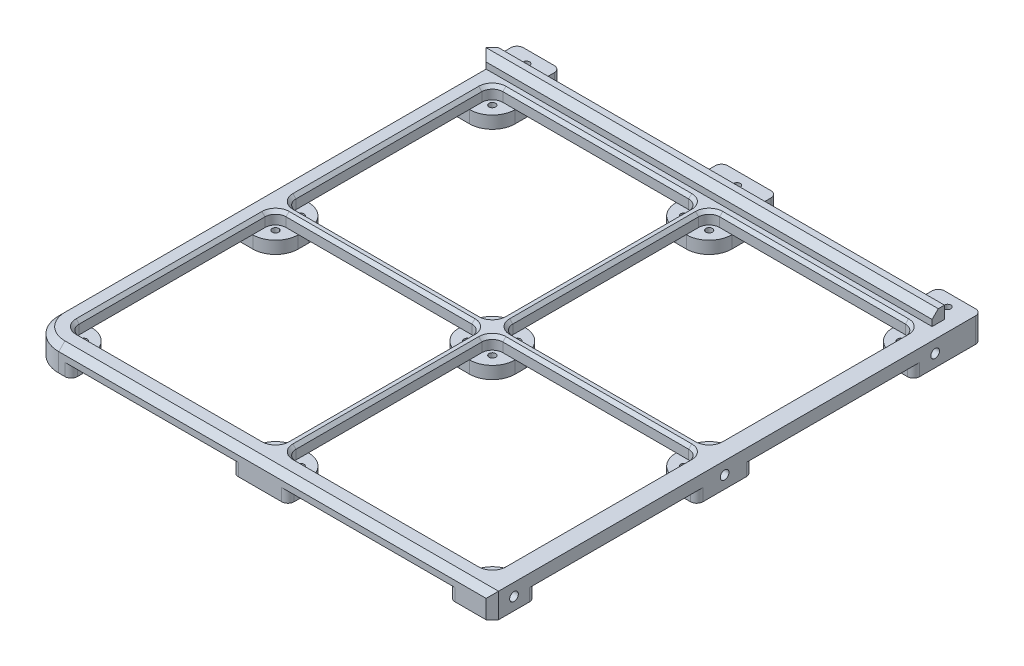
from build123d import *

# Parameters (mm, degrees)
SKETCH1_W              = 225
SKETCH1_H              = 225
SKETCH1_W_2            = 100
SKETCH1_H_2            = 100
BOSS_EXTRUDE1_DEPTH    = 6
SKETCH10_R             = 1.6
BOSS_EXTRUDE9_DEPTH    = 6
FILLET1_R              = 5
SKETCH18_W             = 12
SKETCH18_H             = 27
BOSS_EXTRUDE11_DEPTH   = 12
SKETCH18_H_2           = 21
BOSS_EXTRUDE11_2_DEPTH = 12
BOSS_EXTRUDE11_3_DEPTH = 12
SKETCH18_W_2           = 21
SKETCH18_H_3           = 12
BOSS_EXTRUDE11_4_DEPTH = 12
SKETCH18_W_3           = 27
BOSS_EXTRUDE11_5_DEPTH = 12
SKETCH19_W             = 12
SKETCH19_H             = 21
BOSS_EXTRUDE13_DEPTH   = 12
SKETCH19_H_2           = 27
BOSS_EXTRUDE13_2_DEPTH = 12
BOSS_EXTRUDE13_3_DEPTH = 12
SKETCH21_W             = 6
SKETCH21_H             = 6
BOSS_EXTRUDE14_DEPTH   = 183
SKETCH22_W             = 6
SKETCH22_H             = 6
BOSS_EXTRUDE16_DEPTH   = 183
SKETCH24_W             = 6
SKETCH24_H             = 6
BOSS_EXTRUDE18_DEPTH   = 183
FILLET2_R              = 15
SPLIT2_START           = -6
SPLIT2_OUTLINE_W       = 12
SPLIT2_OUTLINE_H       = 12
SPLIT2_DEPTH           = 12
SPLIT2_START_2         = -112.5
SPLIT2_2_OUTLINE_W     = 6
SPLIT2_2_OUTLINE_H     = 6
SPLIT2_2_DEPTH         = 225
SPLIT2_START_3         = -13.5
SPLIT2_3_DEPTH         = 27
SPLIT2_4_DEPTH         = 21
SPLIT2_START_4         = 91.5
SPLIT2_5_DEPTH         = 21
SPLIT2_START_5         = 112.5
SPLIT2_6_DEPTH         = 6
SPLIT2_START_6         = 118.5
SPLIT2_7_OUTLINE_R     = 1.6
SPLIT2_7_DEPTH         = 6
SPLIT2_START_7         = 6
SPLIT2_8_OUTLINE_W     = 6
SPLIT2_8_OUTLINE_H     = 6
SPLIT2_8_DEPTH         = 225
SPLIT2_START_8         = 105
SPLIT2_9_DEPTH         = 27
SPLIT2_10_DEPTH        = 21
SPLIT2_START_9         = 210
SPLIT2_11_DEPTH        = 21
SPLIT2_START_10        = -118.5
SPLIT2_12_DEPTH        = 6
SPLIT2_START_11        = -124.5
SPLIT2_13_OUTLINE_R    = 1.6
SPLIT2_13_DEPTH        = 6
SPLIT2_14_OUTLINE_W    = 6
SPLIT2_14_OUTLINE_H    = 6
SPLIT2_14_DEPTH        = 225
SPLIT2_15_DEPTH        = 27
SPLIT2_16_DEPTH        = 21
SPLIT2_17_DEPTH        = 21
SPLIT2_18_OUTLINE_R    = 1.6
SPLIT2_18_DEPTH        = 237
SPLIT2_19_DEPTH        = 12
SKETCH26_W             = 6
SKETCH26_H             = 6
BOSS_EXTRUDE20_DEPTH   = 219
SKETCH27_R             = 1.6
CUT_EXTRUDE1_DEPTH     = 169.761666263
SKETCH28_R             = 3
CUT_EXTRUDE2_DEPTH     = 4
SKETCH30_R             = 2.1
CUT_EXTRUDE3_DEPTH     = 6
CUT_EXTRUDE4_DEPTH     = 6
SKETCH32_R             = 1.6
CUT_EXTRUDE5_DEPTH     = 6
CHAMFER7_SIZE          = 1.5
CHAMFER3_SIZE          = 3
FILLET3_R              = 3


# Read off the part's stored shape, not the designer's step: Split2
with BuildPart() as part:
    # Sketch1 → Boss-Extrude1 (new body)
    with BuildSketch(Plane(origin=(0, 0, 0), x_dir=(1, 0, 0), z_dir=(0, 1, 0))):
        Rectangle(SKETCH1_W, SKETCH1_H)
        with Locations((-52.5, 52.5)):
            Rectangle(SKETCH1_W_2, SKETCH1_H_2, mode=Mode.SUBTRACT)
        with Locations((-52.5, -52.5)):
            Rectangle(SKETCH1_W_2, SKETCH1_H_2, mode=Mode.SUBTRACT)
        with Locations((52.5, -52.5)):
            Rectangle(SKETCH1_W_2, SKETCH1_H_2, mode=Mode.SUBTRACT)
        with Locations((52.5, 52.5)):
            Rectangle(SKETCH1_W_2, SKETCH1_H_2, mode=Mode.SUBTRACT)
    extrude(amount=BOSS_EXTRUDE1_DEPTH)

    # Sketch10 → Boss-Extrude9 (add)
    # profile 1 of 9: a face of its own
    with BuildSketch(Plane.XZ):
        with BuildLine():
            Line((-112.5, 91.5), (-102.5, 91.5))
            ThreePointArc((-102.5, 91.5), (-94.721825407, 94.721825407), (-91.5, 102.5))
            Line((-91.5, 102.5), (-91.5, 112.5))
            Line((-91.5, 112.5), (-112.5, 112.5))
            Line((-112.5, 112.5), (-112.5, 91.5))
        make_face()
        with Locations(Location((-98.9, 98.9, 0), (0, 0, 270))):
            Circle(SKETCH10_R, mode=Mode.SUBTRACT)
    # profile 2 of 9: a face of its own
    with BuildSketch(Plane.XZ):
        with BuildLine():
            Line((-2.5, 91.5), (2.5, 91.5))
            ThreePointArc((2.5, 91.5), (10.278174593, 94.721825407), (13.5, 102.5))
            Line((13.5, 102.5), (13.5, 112.5))
            Line((13.5, 112.5), (-13.5, 112.5))
            Line((-13.5, 112.5), (-13.5, 102.5))
            ThreePointArc((-13.5, 102.5), (-10.278174593, 94.721825407), (-2.5, 91.5))
        make_face()
        with Locations(Location((-6.1, 98.9, 0), (0, 0, 270))):
            Circle(SKETCH10_R, mode=Mode.SUBTRACT)
        with Locations(Location((6.1, 98.9, 0), (0, 0, 90))):
            Circle(SKETCH10_R, mode=Mode.SUBTRACT)
    # profile 3 of 9: a face of its own
    with BuildSketch(Plane.XZ):
        with BuildLine():
            Line((-13.5, 2.5), (-13.5, -2.5))
            ThreePointArc((-13.5, -2.5), (-10.278174593, -10.278174593), (-2.5, -13.5))
            Line((-2.5, -13.5), (2.5, -13.5))
            ThreePointArc((2.5, -13.5), (10.278174593, -10.278174593), (13.5, -2.5))
            Line((13.5, -2.5), (13.5, 2.5))
            ThreePointArc((13.5, 2.5), (10.278174593, 10.278174593), (2.5, 13.5))
            Line((2.5, 13.5), (-2.5, 13.5))
            ThreePointArc((-2.5, 13.5), (-10.278174593, 10.278174593), (-13.5, 2.5))
        make_face()
        with Locations(Location((-6.1, 6.1, 0), (0, 0, 270))):
            Circle(SKETCH10_R, mode=Mode.SUBTRACT)
        with Locations(Location((6.1, 6.1, 0), (0, 0, 270))):
            Circle(SKETCH10_R, mode=Mode.SUBTRACT)
        with Locations(Location((6.1, -6.1, 0), (0, 0, 270))):
            Circle(SKETCH10_R, mode=Mode.SUBTRACT)
        with Locations(Location((-6.1, -6.1, 0), (0, 0, 270))):
            Circle(SKETCH10_R, mode=Mode.SUBTRACT)
    # profile 4 of 9: a face of its own
    with BuildSketch(Plane.XZ):
        with BuildLine():
            Line((91.5, 112.5), (91.5, 102.5))
            ThreePointArc((91.5, 102.5), (94.721825407, 94.721825407), (102.5, 91.5))
            Line((102.5, 91.5), (112.5, 91.5))
            Line((112.5, 91.5), (112.5, 112.5))
            Line((112.5, 112.5), (91.5, 112.5))
        make_face()
        with Locations(Location((98.9, 98.9, 0), (0, 0, 270))):
            Circle(SKETCH10_R, mode=Mode.SUBTRACT)
    # profile 5 of 9: a face of its own
    with BuildSketch(Plane.XZ):
        with BuildLine():
            Line((91.5, 2.5), (91.5, -2.5))
            ThreePointArc((91.5, -2.5), (94.721825407, -10.278174593), (102.5, -13.5))
            Line((102.5, -13.5), (112.5, -13.5))
            Line((112.5, -13.5), (112.5, 13.5))
            Line((112.5, 13.5), (102.5, 13.5))
            ThreePointArc((102.5, 13.5), (94.721825407, 10.278174593), (91.5, 2.5))
        make_face()
        with Locations(Location((98.9, 6.1, 0), (0, 0, 270))):
            Circle(SKETCH10_R, mode=Mode.SUBTRACT)
        with Locations(Location((98.9, -6.1, 0), (0, 0, 90))):
            Circle(SKETCH10_R, mode=Mode.SUBTRACT)
    # profile 6 of 9: a face of its own
    with BuildSketch(Plane.XZ):
        with BuildLine():
            Line((112.5, -91.5), (102.5, -91.5))
            ThreePointArc((102.5, -91.5), (94.721825407, -94.721825407), (91.5, -102.5))
            Line((91.5, -102.5), (91.5, -112.5))
            Line((91.5, -112.5), (112.5, -112.5))
            Line((112.5, -112.5), (112.5, -91.5))
        make_face()
        with Locations(Location((98.9, -98.9, 0), (0, 0, 270))):
            Circle(SKETCH10_R, mode=Mode.SUBTRACT)
    # profile 7 of 9: a face of its own
    with BuildSketch(Plane.XZ):
        with BuildLine():
            Line((2.5, -91.5), (-2.5, -91.5))
            ThreePointArc((-2.5, -91.5), (-10.278174593, -94.721825407), (-13.5, -102.5))
            Line((-13.5, -102.5), (-13.5, -112.5))
            Line((-13.5, -112.5), (13.5, -112.5))
            Line((13.5, -112.5), (13.5, -102.5))
            ThreePointArc((13.5, -102.5), (10.278174593, -94.721825407), (2.5, -91.5))
        make_face()
        with Locations(Location((6.1, -98.9, 0), (0, 0, 270))):
            Circle(SKETCH10_R, mode=Mode.SUBTRACT)
        with Locations(Location((-6.1, -98.9, 0), (0, 0, 90))):
            Circle(SKETCH10_R, mode=Mode.SUBTRACT)
    # profile 8 of 9: a face of its own
    with BuildSketch(Plane.XZ):
        with BuildLine():
            Line((-91.5, -112.5), (-91.5, -102.5))
            ThreePointArc((-91.5, -102.5), (-94.721825407, -94.721825407), (-102.5, -91.5))
            Line((-102.5, -91.5), (-112.5, -91.5))
            Line((-112.5, -91.5), (-112.5, -112.5))
            Line((-112.5, -112.5), (-91.5, -112.5))
        make_face()
        with Locations(Location((-98.9, -98.9, 0), (0, 0, 270))):
            Circle(SKETCH10_R, mode=Mode.SUBTRACT)
    # profile 9 of 9: a face of its own
    with BuildSketch(Plane.XZ):
        with BuildLine():
            Line((-91.5, -2.5), (-91.5, 2.5))
            ThreePointArc((-91.5, 2.5), (-94.721825407, 10.278174593), (-102.5, 13.5))
            Line((-102.5, 13.5), (-112.5, 13.5))
            Line((-112.5, 13.5), (-112.5, -13.5))
            Line((-112.5, -13.5), (-102.5, -13.5))
            ThreePointArc((-102.5, -13.5), (-94.721825407, -10.278174593), (-91.5, -2.5))
        make_face()
        with Locations(Location((-98.9, -6.1, 0), (0, 0, 270))):
            Circle(SKETCH10_R, mode=Mode.SUBTRACT)
        with Locations(Location((-98.9, 6.1, 0), (0, 0, 90))):
            Circle(SKETCH10_R, mode=Mode.SUBTRACT)
    extrude(amount=BOSS_EXTRUDE9_DEPTH)

    # Fillet1
    fillet1_edges = [part.edges().sort_by_distance(p)[0] for p in [
        (-102.5, 3, 2.5),
        (-102.5, 3, 102.5),
        (-2.5, 3, 102.5),
        (-2.5, 3, 2.5),
        (-2.5, 3, -2.5),
        (-2.5, 3, -102.5),
        (-102.5, 3, -102.5),
        (-102.5, 3, -2.5),
        (102.5, 3, -2.5),
        (102.5, 3, -102.5),
        (2.5, 3, -102.5),
        (2.5, 3, -2.5),
        (102.5, 3, 2.5),
        (2.5, 3, 2.5),
        (2.5, 3, 102.5),
        (102.5, 3, 102.5),
    ]]
    fillet(fillet1_edges, radius=FILLET1_R)


with BuildPart() as body_2:
    # Mirror2: mirrored copy
    add(part.part.mirror(Plane(origin=(0, 59.25, -59.25), x_dir=(0, 0.7071067811865439, 0.7071067811865511), z_dir=(0, 0.7071067811865511, -0.7071067811865439))))


with BuildPart() as body_3:
    # Mirror3: mirrored copy
    add(part.part.mirror(Plane(origin=(59.25, 59.25, 0), x_dir=(0, 0, 1), z_dir=(-0.7071067811865489, -0.7071067811865462, 0))))


with BuildPart() as body_4:
    # Sketch18 → Boss-Extrude11 (new body)
    with BuildSketch(Plane.XZ.offset(-6)):
        with Locations((118.5, 0)):
            Rectangle(SKETCH18_W, SKETCH18_H)
    extrude(amount=BOSS_EXTRUDE11_DEPTH)


with BuildPart() as body_5:
    # Sketch18 → Boss-Extrude11 2 (new body)
    with BuildSketch(Plane.XZ.offset(-6)):
        with Locations((118.5, 102)):
            Rectangle(SKETCH18_W, SKETCH18_H_2)
    extrude(amount=BOSS_EXTRUDE11_2_DEPTH)


with BuildPart() as body_6:
    # Sketch18 → Boss-Extrude11 3 (new body)
    with BuildSketch(Plane.XZ.offset(-6)):
        Polygon((112.5, -91.5), (124.5, -91.5), (124.5, -124.5), (91.5, -124.5), (91.5, -112.5), (112.5, -112.5), align=None)
    extrude(amount=BOSS_EXTRUDE11_3_DEPTH)


with BuildPart() as body_7:
    # Sketch18 → Boss-Extrude11 4 (new body)
    with BuildSketch(Plane.XZ.offset(-6)):
        with Locations((-102, -118.5)):
            Rectangle(SKETCH18_W_2, SKETCH18_H_3)
    extrude(amount=BOSS_EXTRUDE11_4_DEPTH)


with BuildPart() as body_8:
    # Sketch18 → Boss-Extrude11 5 (new body)
    with BuildSketch(Plane.XZ.offset(-6)):
        with Locations((0, -118.5)):
            Rectangle(SKETCH18_W_3, SKETCH18_H_3)
    extrude(amount=BOSS_EXTRUDE11_5_DEPTH)


with BuildPart() as body_9:
    # Sketch19 → Boss-Extrude13 (new body)
    with BuildSketch(Plane(origin=(0, 0, -112.5), x_dir=(-1, 0, 0), z_dir=(0, 0, -1))):
        with Locations((-118.5, 16.5)):
            Rectangle(SKETCH19_W, SKETCH19_H)
    extrude(amount=BOSS_EXTRUDE13_DEPTH)


with BuildPart() as body_10:
    # Sketch19 → Boss-Extrude13 2 (new body)
    with BuildSketch(Plane(origin=(0, 0, -112.5), x_dir=(-1, 0, 0), z_dir=(0, 0, -1))):
        with Locations((-118.5, 118.5)):
            Rectangle(SKETCH19_W, SKETCH19_H_2)
    extrude(amount=BOSS_EXTRUDE13_2_DEPTH)


with BuildPart() as body_11:
    # Sketch19 → Boss-Extrude13 3 (new body)
    with BuildSketch(Plane(origin=(0, 0, -112.5), x_dir=(-1, 0, 0), z_dir=(0, 0, -1))):
        with Locations((-118.5, 220.5)):
            Rectangle(SKETCH19_W, SKETCH19_H)
    extrude(amount=BOSS_EXTRUDE13_3_DEPTH)


with BuildPart() as body_12:
    # Sketch21 → Boss-Extrude14 (new body)
    with BuildSketch(Plane(origin=(0, 27, 0), x_dir=(1, 0, 0), z_dir=(0, 1, 0))):
        with Locations((115.5, 115.5)):
            Rectangle(SKETCH21_W, SKETCH21_H)
    extrude(amount=BOSS_EXTRUDE14_DEPTH)


with BuildPart() as body_13:
    # Sketch22 → Boss-Extrude16 (new body)
    with BuildSketch(Plane.XY.offset(-91.5)):
        with Locations((115.5, 3)):
            Rectangle(SKETCH22_W, SKETCH22_H)
    extrude(amount=BOSS_EXTRUDE16_DEPTH)


with BuildPart() as body_14:
    # Sketch24 → Boss-Extrude18 (new body)
    with BuildSketch(Plane.ZY.offset(-91.5)):
        with Locations((-115.5, 3)):
            Rectangle(SKETCH24_W, SKETCH24_H)
    extrude(amount=BOSS_EXTRUDE18_DEPTH)


with BuildPart() as part_1:
    add(part.part)

    # Combine1: union body 5, body 7, body 9, body 11, body 4, body 12, body 14, body 8, body 6, body 10, body 13, body 2, body 3
    add(body_5.part)
    add(body_7.part)
    add(body_9.part)
    add(body_11.part)
    add(body_4.part)
    add(body_12.part)
    add(body_14.part)
    add(body_8.part)
    add(body_6.part)
    add(body_10.part)
    add(body_13.part)
    add(body_2.part)
    add(body_3.part)

    # Fillet2
    fillet2_edges = [part_1.edges().sort_by_distance(p)[0] for p in [
        (-112.5, 231, -118.5),
        (118.5, 231, 112.5),
        (-112.5, 0, 112.5),
    ]]
    fillet(fillet2_edges, radius=FILLET2_R)

    # Split2 18 outline → Split2 18 (cut)
    # profile 1 of 5: a face of its own
    with BuildSketch(Plane.XY.offset(SPLIT2_START_11)):
        with BuildLine():
            Line((112.5, -6), (124.5, -6))
            Line((124.5, -6), (124.5, 27))
            Line((124.5, 27), (118.5, 27))
            Line((118.5, 27), (118.5, 105))
            Line((118.5, 105), (124.5, 105))
            Line((124.5, 105), (124.5, 132))
            Line((124.5, 132), (118.5, 132))
            Line((118.5, 132), (118.5, 210))
            Line((118.5, 210), (124.5, 210))
            Line((124.5, 210), (124.5, 231))
            Line((124.5, 231), (-97.5, 231))
            ThreePointArc((-97.5, 231), (-108.106601718, 226.606601718), (-112.5, 216))
            Line((-112.5, 216), (-112.5, 27))
            Line((-112.5, 27), (-102.5, 27))
            Line((-102.5, 27), (-102.5, 105))
            ThreePointArc((-102.5, 105), (-94.721825407, 108.221825407), (-91.5, 116))
            Line((-91.5, 116), (-13.5, 116))
            ThreePointArc((-13.5, 116), (-10.278174593, 108.221825407), (-2.5, 105))
            Line((-2.5, 105), (-2.5, 27))
            Line((-2.5, 27), (2.5, 27))
            Line((2.5, 27), (2.5, 105))
            ThreePointArc((2.5, 105), (10.278174593, 108.221825407), (13.5, 116))
            Line((13.5, 116), (91.5, 116))
            ThreePointArc((91.5, 116), (94.721825407, 108.221825407), (102.5, 105))
            Line((102.5, 105), (102.5, 27))
            Line((102.5, 27), (112.5, 27))
            Line((112.5, 27), (112.5, -6))
        make_face()
        with Locations((98.9, 112.4)):
            Circle(SPLIT2_18_OUTLINE_R, mode=Mode.SUBTRACT)
        with BuildLine():
            Line((91.5, 121), (13.5, 121))
            ThreePointArc((13.5, 121), (10.278174593, 128.778174593), (2.5, 132))
            Line((2.5, 132), (2.5, 210))
            ThreePointArc((2.5, 210), (10.278174593, 213.221825407), (13.5, 221))
            Line((13.5, 221), (91.5, 221))
            ThreePointArc((91.5, 221), (94.721825407, 213.221825407), (102.5, 210))
            Line((102.5, 210), (102.5, 132))
            ThreePointArc((102.5, 132), (94.721825407, 128.778174593), (91.5, 121))
        make_face(mode=Mode.SUBTRACT)
        with Locations((98.9, 124.6)):
            Circle(SPLIT2_18_OUTLINE_R, mode=Mode.SUBTRACT)
        with Locations((6.1, 112.4)):
            Circle(SPLIT2_18_OUTLINE_R, mode=Mode.SUBTRACT)
        with Locations((-6.1, 112.4)):
            Circle(SPLIT2_18_OUTLINE_R, mode=Mode.SUBTRACT)
        with BuildLine():
            Line((-13.5, 121), (-91.5, 121))
            ThreePointArc((-91.5, 121), (-94.721825407, 128.778174593), (-102.5, 132))
            Line((-102.5, 132), (-102.5, 210))
            ThreePointArc((-102.5, 210), (-94.721825407, 213.221825407), (-91.5, 221))
            Line((-91.5, 221), (-13.5, 221))
            ThreePointArc((-13.5, 221), (-10.278174593, 213.221825407), (-2.5, 210))
            Line((-2.5, 210), (-2.5, 132))
            ThreePointArc((-2.5, 132), (-10.278174593, 128.778174593), (-13.5, 121))
        make_face(mode=Mode.SUBTRACT)
        with Locations((-6.1, 124.6)):
            Circle(SPLIT2_18_OUTLINE_R, mode=Mode.SUBTRACT)
        with Locations((6.1, 124.6)):
            Circle(SPLIT2_18_OUTLINE_R, mode=Mode.SUBTRACT)
        with Locations((98.9, 217.4)):
            Circle(SPLIT2_18_OUTLINE_R, mode=Mode.SUBTRACT)
        with Locations((-98.9, 112.4)):
            Circle(SPLIT2_18_OUTLINE_R, mode=Mode.SUBTRACT)
        with Locations((-98.9, 124.6)):
            Circle(SPLIT2_18_OUTLINE_R, mode=Mode.SUBTRACT)
        with Locations((6.1, 217.4)):
            Circle(SPLIT2_18_OUTLINE_R, mode=Mode.SUBTRACT)
        with Locations((-6.1, 217.4)):
            Circle(SPLIT2_18_OUTLINE_R, mode=Mode.SUBTRACT)
        with Locations((-98.9, 217.4)):
            Circle(SPLIT2_18_OUTLINE_R, mode=Mode.SUBTRACT)
    # profile 2 of 5: a face of its own
    with BuildSketch(Plane.XY.offset(SPLIT2_START_11)):
        with BuildLine():
            Line((102.5, 21), (102.5, 27))
            ThreePointArc((102.5, 27), (94.721825407, 23.778174593), (91.5, 16))
            Line((91.5, 16), (97.5, 16))
            ThreePointArc((97.5, 16), (101.035533906, 17.464466094), (102.5, 21))
        make_face()
        with Locations((98.9, 19.6)):
            Circle(SPLIT2_18_OUTLINE_R, mode=Mode.SUBTRACT)
    # profile 3 of 5: a face of its own
    with BuildSketch(Plane.XY.offset(SPLIT2_START_11)):
        with BuildLine():
            Line((7.5, 16), (13.5, 16))
            ThreePointArc((13.5, 16), (10.278174593, 23.778174593), (2.5, 27))
            Line((2.5, 27), (2.5, 21))
            ThreePointArc((2.5, 21), (3.964466094, 17.464466094), (7.5, 16))
        make_face()
        with Locations((6.1, 19.6)):
            Circle(SPLIT2_18_OUTLINE_R, mode=Mode.SUBTRACT)
    # profile 4 of 5: a face of its own
    with BuildSketch(Plane.XY.offset(SPLIT2_START_11)):
        with BuildLine():
            Line((-2.5, 21), (-2.5, 27))
            ThreePointArc((-2.5, 27), (-10.278174593, 23.778174593), (-13.5, 16))
            Line((-13.5, 16), (-7.5, 16))
            ThreePointArc((-7.5, 16), (-3.964466094, 17.464466094), (-2.5, 21))
        make_face()
        with Locations((-6.1, 19.6)):
            Circle(SPLIT2_18_OUTLINE_R, mode=Mode.SUBTRACT)
    # profile 5 of 5: a face of its own
    with BuildSketch(Plane.XY.offset(SPLIT2_START_11)):
        with BuildLine():
            Line((-97.5, 16), (-91.5, 16))
            ThreePointArc((-91.5, 16), (-94.721825407, 23.778174593), (-102.5, 27))
            Line((-102.5, 27), (-102.5, 21))
            ThreePointArc((-102.5, 21), (-101.035533906, 17.464466094), (-97.5, 16))
        make_face()
        with Locations((-98.9, 19.6)):
            Circle(SPLIT2_18_OUTLINE_R, mode=Mode.SUBTRACT)
    extrude(amount=SPLIT2_18_DEPTH, mode=Mode.SUBTRACT)

    # Split2 19 outline → Split2 19 (cut)
    with BuildSketch(Plane.XY.offset(SPLIT2_START_11)):
        with BuildLine():
            Line((112.5, 0), (112.5, 27))
            Line((112.5, 27), (102.5, 27))
            Line((102.5, 27), (102.5, 21))
            ThreePointArc((102.5, 21), (101.035533906, 17.464466094), (97.5, 16))
            Line((97.5, 16), (7.5, 16))
            ThreePointArc((7.5, 16), (3.964466094, 17.464466094), (2.5, 21))
            Line((2.5, 21), (2.5, 27))
            Line((2.5, 27), (-2.5, 27))
            Line((-2.5, 27), (-2.5, 21))
            ThreePointArc((-2.5, 21), (-3.964466094, 17.464466094), (-7.5, 16))
            Line((-7.5, 16), (-97.5, 16))
            ThreePointArc((-97.5, 16), (-101.035533906, 17.464466094), (-102.5, 21))
            Line((-102.5, 21), (-102.5, 27))
            Line((-102.5, 27), (-112.5, 27))
            Line((-112.5, 27), (-112.5, -6))
            Line((-112.5, -6), (-91.5, -6))
            Line((-91.5, -6), (-91.5, 0))
            Line((-91.5, 0), (-13.5, 0))
            Line((-13.5, 0), (-13.5, -6))
            Line((-13.5, -6), (13.5, -6))
            Line((13.5, -6), (13.5, 0))
            Line((13.5, 0), (91.5, 0))
            Line((91.5, 0), (91.5, -6))
            Line((91.5, -6), (112.5, -6))
            Line((112.5, -6), (112.5, 0))
        make_face()
    extrude(amount=SPLIT2_19_DEPTH, mode=Mode.SUBTRACT)


with BuildPart() as body_2_2:
    # Split2 outline → Split2 (new body)
    with BuildSketch(Plane(origin=(0, 0, 0), x_dir=(1, 0, 0), z_dir=(0, 1, 0)).offset(SPLIT2_START)):
        with Locations((118.5, 118.5)):
            Rectangle(SPLIT2_OUTLINE_W, SPLIT2_OUTLINE_H)
    extrude(amount=SPLIT2_DEPTH)


with BuildPart() as body_3_2:
    # Split2 2 outline → Split2 2 (new body)
    with BuildSketch(Plane.XY.offset(SPLIT2_START_2)):
        with Locations((115.5, 3)):
            Rectangle(SPLIT2_2_OUTLINE_W, SPLIT2_2_OUTLINE_H)
    extrude(amount=SPLIT2_2_DEPTH)

    # Split2 3 outline → Split2 3 (add)
    with BuildSketch(Plane.XY.offset(SPLIT2_START_3)):
        Polygon((124.5, -6), (124.5, 6), (118.5, 6), (118.5, 0), (112.5, 0), (112.5, -6), align=None)
    extrude(amount=SPLIT2_3_DEPTH)

    # Split2 4 outline → Split2 4 (add)
    with BuildSketch(Plane.XY.offset(SPLIT2_START_2)):
        Polygon((124.5, -6), (124.5, 6), (118.5, 6), (118.5, 0), (112.5, 0), (112.5, -6), align=None)
    extrude(amount=SPLIT2_4_DEPTH)

    # Split2 5 outline → Split2 5 (add)
    with BuildSketch(Plane.XY.offset(SPLIT2_START_4)):
        Polygon((124.5, -6), (124.5, 6), (118.5, 6), (118.5, 0), (112.5, 0), (112.5, -6), align=None)
    extrude(amount=SPLIT2_5_DEPTH)


with BuildPart() as body_4_2:
    # Split2 6 outline → Split2 6 (new body)
    with BuildSketch(Plane.YZ.offset(SPLIT2_START_5)):
        with BuildLine():
            Line((231, -112.5), (231, 97.5))
            ThreePointArc((231, 97.5), (226.606601718, 108.106601718), (216, 112.5))
            Line((216, 112.5), (6, 112.5))
            Line((6, 112.5), (6, -112.5))
            Line((6, -112.5), (231, -112.5))
        make_face()
        with BuildLine():
            Line((216, -102.5), (126, -102.5))
            ThreePointArc((126, -102.5), (122.464466094, -101.035533906), (121, -97.5))
            Line((121, -97.5), (121, -7.5))
            ThreePointArc((121, -7.5), (122.464466094, -3.964466094), (126, -2.5))
            Line((126, -2.5), (216, -2.5))
            ThreePointArc((216, -2.5), (219.535533906, -3.964466094), (221, -7.5))
            Line((221, -7.5), (221, -97.5))
            ThreePointArc((221, -97.5), (219.535533906, -101.035533906), (216, -102.5))
        make_face(mode=Mode.SUBTRACT)
        with BuildLine():
            Line((111, -102.5), (21, -102.5))
            ThreePointArc((21, -102.5), (17.464466094, -101.035533906), (16, -97.5))
            Line((16, -97.5), (16, -7.5))
            ThreePointArc((16, -7.5), (17.464466094, -3.964466094), (21, -2.5))
            Line((21, -2.5), (111, -2.5))
            ThreePointArc((111, -2.5), (114.535533906, -3.964466094), (116, -7.5))
            Line((116, -7.5), (116, -97.5))
            ThreePointArc((116, -97.5), (114.535533906, -101.035533906), (111, -102.5))
        make_face(mode=Mode.SUBTRACT)
        with BuildLine():
            Line((216, 2.5), (126, 2.5))
            ThreePointArc((126, 2.5), (122.464466094, 3.964466094), (121, 7.5))
            Line((121, 7.5), (121, 97.5))
            ThreePointArc((121, 97.5), (122.464466094, 101.035533906), (126, 102.5))
            Line((126, 102.5), (216, 102.5))
            ThreePointArc((216, 102.5), (219.535533906, 101.035533906), (221, 97.5))
            Line((221, 97.5), (221, 7.5))
            ThreePointArc((221, 7.5), (219.535533906, 3.964466094), (216, 2.5))
        make_face(mode=Mode.SUBTRACT)
        with BuildLine():
            Line((111, 2.5), (21, 2.5))
            ThreePointArc((21, 2.5), (17.464466094, 3.964466094), (16, 7.5))
            Line((16, 7.5), (16, 97.5))
            ThreePointArc((16, 97.5), (17.464466094, 101.035533906), (21, 102.5))
            Line((21, 102.5), (111, 102.5))
            ThreePointArc((111, 102.5), (114.535533906, 101.035533906), (116, 97.5))
            Line((116, 97.5), (116, 7.5))
            ThreePointArc((116, 7.5), (114.535533906, 3.964466094), (111, 2.5))
        make_face(mode=Mode.SUBTRACT)
    extrude(amount=SPLIT2_6_DEPTH)

    # Split2 7 outline → Split2 7 (add)
    # profile 1 of 9: a face of its own
    with BuildSketch(Plane.YZ.offset(SPLIT2_START_6)):
        with BuildLine():
            Line((210, -112.5), (231, -112.5))
            Line((231, -112.5), (231, -91.5))
            Line((231, -91.5), (221, -91.5))
            ThreePointArc((221, -91.5), (213.221825407, -94.721825407), (210, -102.5))
            Line((210, -102.5), (210, -112.5))
        make_face()
        with Locations((217.4, -98.9)):
            Circle(SPLIT2_7_OUTLINE_R, mode=Mode.SUBTRACT)
    # profile 2 of 9: a face of its own
    with BuildSketch(Plane.YZ.offset(SPLIT2_START_6)):
        with BuildLine():
            Line((105, -112.5), (132, -112.5))
            Line((132, -112.5), (132, -102.5))
            ThreePointArc((132, -102.5), (128.778174593, -94.721825407), (121, -91.5))
            Line((121, -91.5), (116, -91.5))
            ThreePointArc((116, -91.5), (108.221825407, -94.721825407), (105, -102.5))
            Line((105, -102.5), (105, -112.5))
        make_face()
        with Locations((112.4, -98.9)):
            Circle(SPLIT2_7_OUTLINE_R, mode=Mode.SUBTRACT)
        with Locations((124.6, -98.9)):
            Circle(SPLIT2_7_OUTLINE_R, mode=Mode.SUBTRACT)
    # profile 3 of 9: a face of its own
    with BuildSketch(Plane.YZ.offset(SPLIT2_START_6)):
        with BuildLine():
            Line((221, -13.5), (231, -13.5))
            Line((231, -13.5), (231, 13.5))
            Line((231, 13.5), (221, 13.5))
            ThreePointArc((221, 13.5), (213.221825407, 10.278174593), (210, 2.5))
            Line((210, 2.5), (210, -2.5))
            ThreePointArc((210, -2.5), (213.221825407, -10.278174593), (221, -13.5))
        make_face()
        with Locations((217.4, -6.1)):
            Circle(SPLIT2_7_OUTLINE_R, mode=Mode.SUBTRACT)
        with Locations((217.4, 6.1)):
            Circle(SPLIT2_7_OUTLINE_R, mode=Mode.SUBTRACT)
    # profile 4 of 9: a face of its own
    with BuildSketch(Plane.YZ.offset(SPLIT2_START_6)):
        with BuildLine():
            Line((6, -112.5), (27, -112.5))
            Line((27, -112.5), (27, -102.5))
            ThreePointArc((27, -102.5), (23.778174593, -94.721825407), (16, -91.5))
            Line((16, -91.5), (6, -91.5))
            Line((6, -91.5), (6, -112.5))
        make_face()
        with Locations((19.6, -98.9)):
            Circle(SPLIT2_7_OUTLINE_R, mode=Mode.SUBTRACT)
    # profile 5 of 9: a face of its own
    with BuildSketch(Plane.YZ.offset(SPLIT2_START_6)):
        with BuildLine():
            Line((221, 91.5), (231, 91.5))
            Line((231, 91.5), (231, 97.5))
            ThreePointArc((231, 97.5), (226.606601718, 108.106601718), (216, 112.5))
            Line((216, 112.5), (210, 112.5))
            Line((210, 112.5), (210, 102.5))
            ThreePointArc((210, 102.5), (213.221825407, 94.721825407), (221, 91.5))
        make_face()
        with Locations((217.4, 98.9)):
            Circle(SPLIT2_7_OUTLINE_R, mode=Mode.SUBTRACT)
    # profile 6 of 9: a face of its own
    with BuildSketch(Plane.YZ.offset(SPLIT2_START_6)):
        with BuildLine():
            ThreePointArc((121, -13.5), (128.778174593, -10.278174593), (132, -2.5))
            Line((132, -2.5), (132, 2.5))
            ThreePointArc((132, 2.5), (128.778174593, 10.278174593), (121, 13.5))
            Line((121, 13.5), (116, 13.5))
            ThreePointArc((116, 13.5), (108.221825407, 10.278174593), (105, 2.5))
            Line((105, 2.5), (105, -2.5))
            ThreePointArc((105, -2.5), (108.221825407, -10.278174593), (116, -13.5))
            Line((116, -13.5), (121, -13.5))
        make_face()
        with Locations((124.6, -6.1)):
            Circle(SPLIT2_7_OUTLINE_R, mode=Mode.SUBTRACT)
        with Locations((112.4, -6.1)):
            Circle(SPLIT2_7_OUTLINE_R, mode=Mode.SUBTRACT)
        with Locations((112.4, 6.1)):
            Circle(SPLIT2_7_OUTLINE_R, mode=Mode.SUBTRACT)
        with Locations((124.6, 6.1)):
            Circle(SPLIT2_7_OUTLINE_R, mode=Mode.SUBTRACT)
    # profile 7 of 9: a face of its own
    with BuildSketch(Plane.YZ.offset(SPLIT2_START_6)):
        with BuildLine():
            Line((6, 13.5), (6, -13.5))
            Line((6, -13.5), (16, -13.5))
            ThreePointArc((16, -13.5), (23.778174593, -10.278174593), (27, -2.5))
            Line((27, -2.5), (27, 2.5))
            ThreePointArc((27, 2.5), (23.778174593, 10.278174593), (16, 13.5))
            Line((16, 13.5), (6, 13.5))
        make_face()
        with Locations((19.6, 6.1)):
            Circle(SPLIT2_7_OUTLINE_R, mode=Mode.SUBTRACT)
        with Locations((19.6, -6.1)):
            Circle(SPLIT2_7_OUTLINE_R, mode=Mode.SUBTRACT)
    # profile 8 of 9: a face of its own
    with BuildSketch(Plane.YZ.offset(SPLIT2_START_6)):
        with BuildLine():
            Line((116, 91.5), (121, 91.5))
            ThreePointArc((121, 91.5), (128.778174593, 94.721825407), (132, 102.5))
            Line((132, 102.5), (132, 112.5))
            Line((132, 112.5), (105, 112.5))
            Line((105, 112.5), (105, 102.5))
            ThreePointArc((105, 102.5), (108.221825407, 94.721825407), (116, 91.5))
        make_face()
        with Locations((124.6, 98.9)):
            Circle(SPLIT2_7_OUTLINE_R, mode=Mode.SUBTRACT)
        with Locations((112.4, 98.9)):
            Circle(SPLIT2_7_OUTLINE_R, mode=Mode.SUBTRACT)
    # profile 9 of 9: a face of its own
    with BuildSketch(Plane.YZ.offset(SPLIT2_START_6)):
        with BuildLine():
            Line((6, 112.5), (6, 91.5))
            Line((6, 91.5), (16, 91.5))
            ThreePointArc((16, 91.5), (23.778174593, 94.721825407), (27, 102.5))
            Line((27, 102.5), (27, 112.5))
            Line((27, 112.5), (6, 112.5))
        make_face()
        with Locations((19.6, 98.9)):
            Circle(SPLIT2_7_OUTLINE_R, mode=Mode.SUBTRACT)
    extrude(amount=SPLIT2_7_DEPTH)

    # Combine4: union body 3 2
    add(body_3_2.part)


with BuildPart() as body_5_2:
    # Split2 8 outline → Split2 8 (new body)
    with BuildSketch(Plane(origin=(0, 0, 0), x_dir=(1, 0, 0), z_dir=(0, 1, 0)).offset(SPLIT2_START_7)):
        with Locations((115.5, 115.5)):
            Rectangle(SPLIT2_8_OUTLINE_W, SPLIT2_8_OUTLINE_H)
    extrude(amount=SPLIT2_8_DEPTH)

    # Split2 9 outline → Split2 9 (add)
    with BuildSketch(Plane(origin=(0, 0, 0), x_dir=(1, 0, 0), z_dir=(0, 1, 0)).offset(SPLIT2_START_8)):
        Polygon((118.5, 118.5), (118.5, 112.5), (124.5, 112.5), (124.5, 124.5), (112.5, 124.5), (112.5, 118.5), align=None)
    extrude(amount=SPLIT2_9_DEPTH)

    # Split2 10 outline → Split2 10 (add)
    with BuildSketch(Plane(origin=(0, 0, 0), x_dir=(1, 0, 0), z_dir=(0, 1, 0)).offset(SPLIT2_START_7)):
        Polygon((118.5, 118.5), (118.5, 112.5), (124.5, 112.5), (124.5, 124.5), (112.5, 124.5), (112.5, 118.5), align=None)
    extrude(amount=SPLIT2_10_DEPTH)

    # Split2 11 outline → Split2 11 (add)
    with BuildSketch(Plane(origin=(0, 0, 0), x_dir=(1, 0, 0), z_dir=(0, 1, 0)).offset(SPLIT2_START_9)):
        Polygon((118.5, 118.5), (118.5, 112.5), (124.5, 112.5), (124.5, 124.5), (112.5, 124.5), (112.5, 118.5), align=None)
    extrude(amount=SPLIT2_11_DEPTH)


with BuildPart() as body_6_2:
    # Split2 12 outline → Split2 12 (new body)
    with BuildSketch(Plane.XY.offset(SPLIT2_START_10)):
        with BuildLine():
            Line((112.5, 6), (112.5, 231))
            Line((112.5, 231), (-97.5, 231))
            ThreePointArc((-97.5, 231), (-108.106601718, 226.606601718), (-112.5, 216))
            Line((-112.5, 216), (-112.5, 6))
            Line((-112.5, 6), (112.5, 6))
        make_face()
        with BuildLine():
            Line((97.5, 16), (7.5, 16))
            ThreePointArc((7.5, 16), (3.964466094, 17.464466094), (2.5, 21))
            Line((2.5, 21), (2.5, 111))
            ThreePointArc((2.5, 111), (3.964466094, 114.535533906), (7.5, 116))
            Line((7.5, 116), (97.5, 116))
            ThreePointArc((97.5, 116), (101.035533906, 114.535533906), (102.5, 111))
            Line((102.5, 111), (102.5, 21))
            ThreePointArc((102.5, 21), (101.035533906, 17.464466094), (97.5, 16))
        make_face(mode=Mode.SUBTRACT)
        with BuildLine():
            Line((-7.5, 16), (-97.5, 16))
            ThreePointArc((-97.5, 16), (-101.035533906, 17.464466094), (-102.5, 21))
            Line((-102.5, 21), (-102.5, 111))
            ThreePointArc((-102.5, 111), (-101.035533906, 114.535533906), (-97.5, 116))
            Line((-97.5, 116), (-7.5, 116))
            ThreePointArc((-7.5, 116), (-3.964466094, 114.535533906), (-2.5, 111))
            Line((-2.5, 111), (-2.5, 21))
            ThreePointArc((-2.5, 21), (-3.964466094, 17.464466094), (-7.5, 16))
        make_face(mode=Mode.SUBTRACT)
        with BuildLine():
            Line((97.5, 121), (7.5, 121))
            ThreePointArc((7.5, 121), (3.964466094, 122.464466094), (2.5, 126))
            Line((2.5, 126), (2.5, 216))
            ThreePointArc((2.5, 216), (3.964466094, 219.535533906), (7.5, 221))
            Line((7.5, 221), (97.5, 221))
            ThreePointArc((97.5, 221), (101.035533906, 219.535533906), (102.5, 216))
            Line((102.5, 216), (102.5, 126))
            ThreePointArc((102.5, 126), (101.035533906, 122.464466094), (97.5, 121))
        make_face(mode=Mode.SUBTRACT)
        with BuildLine():
            Line((-7.5, 121), (-97.5, 121))
            ThreePointArc((-97.5, 121), (-101.035533906, 122.464466094), (-102.5, 126))
            Line((-102.5, 126), (-102.5, 216))
            ThreePointArc((-102.5, 216), (-101.035533906, 219.535533906), (-97.5, 221))
            Line((-97.5, 221), (-7.5, 221))
            ThreePointArc((-7.5, 221), (-3.964466094, 219.535533906), (-2.5, 216))
            Line((-2.5, 216), (-2.5, 126))
            ThreePointArc((-2.5, 126), (-3.964466094, 122.464466094), (-7.5, 121))
        make_face(mode=Mode.SUBTRACT)
    extrude(amount=SPLIT2_12_DEPTH)

    # Split2 13 outline → Split2 13 (add)
    # profile 1 of 9: a face of its own
    with BuildSketch(Plane.XY.offset(SPLIT2_START_11)):
        with BuildLine():
            Line((91.5, 6), (112.5, 6))
            Line((112.5, 6), (112.5, 27))
            Line((112.5, 27), (102.5, 27))
            ThreePointArc((102.5, 27), (94.721825407, 23.778174593), (91.5, 16))
            Line((91.5, 16), (91.5, 6))
        make_face()
        with Locations((98.9, 19.6)):
            Circle(SPLIT2_13_OUTLINE_R, mode=Mode.SUBTRACT)
    # profile 2 of 9: a face of its own
    with BuildSketch(Plane.XY.offset(SPLIT2_START_11)):
        with BuildLine():
            Line((-13.5, 6), (13.5, 6))
            Line((13.5, 6), (13.5, 16))
            ThreePointArc((13.5, 16), (10.278174593, 23.778174593), (2.5, 27))
            Line((2.5, 27), (-2.5, 27))
            ThreePointArc((-2.5, 27), (-10.278174593, 23.778174593), (-13.5, 16))
            Line((-13.5, 16), (-13.5, 6))
        make_face()
        with Locations((-6.1, 19.6)):
            Circle(SPLIT2_13_OUTLINE_R, mode=Mode.SUBTRACT)
        with Locations((6.1, 19.6)):
            Circle(SPLIT2_13_OUTLINE_R, mode=Mode.SUBTRACT)
    # profile 3 of 9: a face of its own
    with BuildSketch(Plane.XY.offset(SPLIT2_START_11)):
        with BuildLine():
            Line((102.5, 105), (112.5, 105))
            Line((112.5, 105), (112.5, 132))
            Line((112.5, 132), (102.5, 132))
            ThreePointArc((102.5, 132), (94.721825407, 128.778174593), (91.5, 121))
            Line((91.5, 121), (91.5, 116))
            ThreePointArc((91.5, 116), (94.721825407, 108.221825407), (102.5, 105))
        make_face()
        with Locations((98.9, 112.4)):
            Circle(SPLIT2_13_OUTLINE_R, mode=Mode.SUBTRACT)
        with Locations((98.9, 124.6)):
            Circle(SPLIT2_13_OUTLINE_R, mode=Mode.SUBTRACT)
    # profile 4 of 9: a face of its own
    with BuildSketch(Plane.XY.offset(SPLIT2_START_11)):
        with BuildLine():
            Line((-112.5, 6), (-91.5, 6))
            Line((-91.5, 6), (-91.5, 16))
            ThreePointArc((-91.5, 16), (-94.721825407, 23.778174593), (-102.5, 27))
            Line((-102.5, 27), (-112.5, 27))
            Line((-112.5, 27), (-112.5, 6))
        make_face()
        with Locations((-98.9, 19.6)):
            Circle(SPLIT2_13_OUTLINE_R, mode=Mode.SUBTRACT)
    # profile 5 of 9: a face of its own
    with BuildSketch(Plane.XY.offset(SPLIT2_START_11)):
        with BuildLine():
            Line((102.5, 210), (112.5, 210))
            Line((112.5, 210), (112.5, 231))
            Line((112.5, 231), (91.5, 231))
            Line((91.5, 231), (91.5, 221))
            ThreePointArc((91.5, 221), (94.721825407, 213.221825407), (102.5, 210))
        make_face()
        with Locations((98.9, 217.4)):
            Circle(SPLIT2_13_OUTLINE_R, mode=Mode.SUBTRACT)
    # profile 6 of 9: a face of its own
    with BuildSketch(Plane.XY.offset(SPLIT2_START_11)):
        with BuildLine():
            ThreePointArc((2.5, 105), (10.278174593, 108.221825407), (13.5, 116))
            Line((13.5, 116), (13.5, 121))
            ThreePointArc((13.5, 121), (10.278174593, 128.778174593), (2.5, 132))
            Line((2.5, 132), (-2.5, 132))
            ThreePointArc((-2.5, 132), (-10.278174593, 128.778174593), (-13.5, 121))
            Line((-13.5, 121), (-13.5, 116))
            ThreePointArc((-13.5, 116), (-10.278174593, 108.221825407), (-2.5, 105))
            Line((-2.5, 105), (2.5, 105))
        make_face()
        with Locations((6.1, 112.4)):
            Circle(SPLIT2_13_OUTLINE_R, mode=Mode.SUBTRACT)
        with Locations((-6.1, 112.4)):
            Circle(SPLIT2_13_OUTLINE_R, mode=Mode.SUBTRACT)
        with Locations((-6.1, 124.6)):
            Circle(SPLIT2_13_OUTLINE_R, mode=Mode.SUBTRACT)
        with Locations((6.1, 124.6)):
            Circle(SPLIT2_13_OUTLINE_R, mode=Mode.SUBTRACT)
    # profile 7 of 9: a face of its own
    with BuildSketch(Plane.XY.offset(SPLIT2_START_11)):
        with BuildLine():
            Line((-112.5, 132), (-112.5, 105))
            Line((-112.5, 105), (-102.5, 105))
            ThreePointArc((-102.5, 105), (-94.721825407, 108.221825407), (-91.5, 116))
            Line((-91.5, 116), (-91.5, 121))
            ThreePointArc((-91.5, 121), (-94.721825407, 128.778174593), (-102.5, 132))
            Line((-102.5, 132), (-112.5, 132))
        make_face()
        with Locations((-98.9, 124.6)):
            Circle(SPLIT2_13_OUTLINE_R, mode=Mode.SUBTRACT)
        with Locations((-98.9, 112.4)):
            Circle(SPLIT2_13_OUTLINE_R, mode=Mode.SUBTRACT)
    # profile 8 of 9: a face of its own
    with BuildSketch(Plane.XY.offset(SPLIT2_START_11)):
        with BuildLine():
            Line((13.5, 221), (13.5, 231))
            Line((13.5, 231), (-13.5, 231))
            Line((-13.5, 231), (-13.5, 221))
            ThreePointArc((-13.5, 221), (-10.278174593, 213.221825407), (-2.5, 210))
            Line((-2.5, 210), (2.5, 210))
            ThreePointArc((2.5, 210), (10.278174593, 213.221825407), (13.5, 221))
        make_face()
        with Locations((6.1, 217.4)):
            Circle(SPLIT2_13_OUTLINE_R, mode=Mode.SUBTRACT)
        with Locations((-6.1, 217.4)):
            Circle(SPLIT2_13_OUTLINE_R, mode=Mode.SUBTRACT)
    # profile 9 of 9: a face of its own
    with BuildSketch(Plane.XY.offset(SPLIT2_START_11)):
        with BuildLine():
            Line((-112.5, 216), (-112.5, 210))
            Line((-112.5, 210), (-102.5, 210))
            ThreePointArc((-102.5, 210), (-94.721825407, 213.221825407), (-91.5, 221))
            Line((-91.5, 221), (-91.5, 231))
            Line((-91.5, 231), (-97.5, 231))
            ThreePointArc((-97.5, 231), (-108.106601718, 226.606601718), (-112.5, 216))
        make_face()
        with Locations((-98.9, 217.4)):
            Circle(SPLIT2_13_OUTLINE_R, mode=Mode.SUBTRACT)
    extrude(amount=SPLIT2_13_DEPTH)

    # Combine3: union body 5 2
    add(body_5_2.part)


with BuildPart() as body_7_2:
    # Split2 14 outline → Split2 14 (new body)
    with BuildSketch(Plane.YZ.offset(SPLIT2_START_2)):
        with Locations((3, -115.5)):
            Rectangle(SPLIT2_14_OUTLINE_W, SPLIT2_14_OUTLINE_H)
    extrude(amount=SPLIT2_14_DEPTH)

    # Split2 15 outline → Split2 15 (add)
    with BuildSketch(Plane.YZ.offset(SPLIT2_START_3)):
        Polygon((-6, -124.5), (6, -124.5), (6, -118.5), (0, -118.5), (0, -112.5), (-6, -112.5), align=None)
    extrude(amount=SPLIT2_15_DEPTH)

    # Split2 16 outline → Split2 16 (add)
    with BuildSketch(Plane.YZ.offset(SPLIT2_START_2)):
        Polygon((-6, -124.5), (6, -124.5), (6, -118.5), (0, -118.5), (0, -112.5), (-6, -112.5), align=None)
    extrude(amount=SPLIT2_16_DEPTH)

    # Split2 17 outline → Split2 17 (add)
    with BuildSketch(Plane.YZ.offset(SPLIT2_START_4)):
        Polygon((-6, -124.5), (6, -124.5), (6, -118.5), (0, -118.5), (0, -112.5), (-6, -112.5), align=None)
    extrude(amount=SPLIT2_17_DEPTH)


with BuildPart() as part_2:
    add(part_1.part)

    # Combine2: union body 7 2
    add(body_7_2.part)

    # Sketch26 → Boss-Extrude20 (add)
    with BuildSketch(Plane.ZY.offset(112.5)):
        with Locations((-109.5, 9)):
            Rectangle(SKETCH26_W, SKETCH26_H)
    extrude(amount=-BOSS_EXTRUDE20_DEPTH)

    # Sketch27 → Cut-Extrude1 (cut, through all)
    with BuildSketch(Plane.XZ.offset(6)):
        with Locations(Location((0, -118.5, 0), (0, 0, 270))):
            Circle(SKETCH27_R)
        with Locations(Location((102, -118.5, 0), (0, 0, 270))):
            Circle(SKETCH27_R)
        with Locations(Location((-102, -118.5, 0), (0, 0, 90))):
            Circle(SKETCH27_R)
    extrude(amount=-CUT_EXTRUDE1_DEPTH, mode=Mode.SUBTRACT)

    # Sketch28 → Cut-Extrude2 (cut)
    with BuildSketch(Plane.XZ.offset(6)):
        with Locations(Location((-102, -118.5, 0), (0, 0, 270))):
            Circle(SKETCH28_R)
        with Locations(Location((0, -118.5, 0), (0, 0, 270))):
            Circle(SKETCH28_R)
        with Locations(Location((102, -118.5, 0), (0, 0, 270))):
            Circle(SKETCH28_R)
    extrude(amount=-CUT_EXTRUDE2_DEPTH, mode=Mode.SUBTRACT)

    # Sketch30 → Cut-Extrude3 (cut)
    with BuildSketch(Plane(origin=(112.5, 0, 0), x_dir=(0, 0, -1), z_dir=(1, 0, 0))):
        with Locations((102, 0)):
            Circle(SKETCH30_R)
        Circle(SKETCH30_R)
        with Locations(Location((-102, 0, 0), (0, 0, 180))):
            Circle(SKETCH30_R)
    extrude(amount=-CUT_EXTRUDE3_DEPTH, mode=Mode.SUBTRACT)

    # Sketch31 → Cut-Extrude4 (cut)
    with BuildSketch(Plane(origin=(0, 6, 0), x_dir=(1, 0, 0), z_dir=(0, 1, 0))):
        with BuildLine():
            Line((97.5, -2.4), (7.5, -2.4))
            ThreePointArc((7.5, -2.4), (3.893755416, -3.893755416), (2.4, -7.5))
            Line((2.4, -7.5), (2.4, -97.5))
            ThreePointArc((2.4, -97.5), (3.893755416, -101.106244584), (7.5, -102.6))
            Line((7.5, -102.6), (97.5, -102.6))
            ThreePointArc((97.5, -102.6), (101.106244584, -101.106244584), (102.6, -97.5))
            Line((102.6, -97.5), (102.6, -7.5))
            ThreePointArc((102.6, -7.5), (101.106244584, -3.893755416), (97.5, -2.4))
        make_face()
        with BuildLine():
            Line((-2.4, -97.5), (-2.4, -7.5))
            ThreePointArc((-2.4, -7.5), (-3.893755416, -3.893755416), (-7.5, -2.4))
            Line((-7.5, -2.4), (-97.5, -2.4))
            ThreePointArc((-97.5, -2.4), (-101.106244584, -3.893755416), (-102.6, -7.5))
            Line((-102.6, -7.5), (-102.6, -97.5))
            ThreePointArc((-102.6, -97.5), (-101.106244584, -101.106244584), (-97.5, -102.6))
            Line((-97.5, -102.6), (-7.5, -102.6))
            ThreePointArc((-7.5, -102.6), (-3.893755416, -101.106244584), (-2.4, -97.5))
        make_face()
        with BuildLine():
            Line((-97.5, 2.4), (-7.5, 2.4))
            ThreePointArc((-7.5, 2.4), (-3.893755416, 3.893755416), (-2.4, 7.5))
            Line((-2.4, 7.5), (-2.4, 97.5))
            ThreePointArc((-2.4, 97.5), (-3.893755416, 101.106244584), (-7.5, 102.6))
            Line((-7.5, 102.6), (-97.5, 102.6))
            ThreePointArc((-97.5, 102.6), (-101.106244584, 101.106244584), (-102.6, 97.5))
            Line((-102.6, 97.5), (-102.6, 7.5))
            ThreePointArc((-102.6, 7.5), (-101.106244584, 3.893755416), (-97.5, 2.4))
        make_face()
        with BuildLine():
            Line((2.4, 97.5), (2.4, 7.5))
            ThreePointArc((2.4, 7.5), (3.893755416, 3.893755416), (7.5, 2.4))
            Line((7.5, 2.4), (97.5, 2.4))
            ThreePointArc((97.5, 2.4), (101.106244584, 3.893755416), (102.6, 7.5))
            Line((102.6, 7.5), (102.6, 97.5))
            ThreePointArc((102.6, 97.5), (101.106244584, 101.106244584), (97.5, 102.6))
            Line((97.5, 102.6), (7.5, 102.6))
            ThreePointArc((7.5, 102.6), (3.893755416, 101.106244584), (2.4, 97.5))
        make_face()
    extrude(amount=-CUT_EXTRUDE4_DEPTH, mode=Mode.SUBTRACT)

    # Sketch32 → Cut-Extrude5 (cut)
    with BuildSketch(Plane.XZ.offset(6)):
        with Locations(Location((0, 0, 0), (0, 0, 270))):
            Circle(SKETCH32_R)
        with Locations(Location((0, 107.5, 0), (0, 0, 270))):
            Circle(SKETCH32_R)
        with Locations(Location((-107.525, 0, 0), (0, 0, 270))):
            Circle(SKETCH32_R)
        with Locations(Location((-102.5, 102.5, 0), (0, 0, 270))):
            Circle(SKETCH32_R)
        with Locations(Location((102.5, 0, 0), (0, 0, 90))):
            Circle(SKETCH32_R)
        with Locations(Location((102.5, 102.5, 0), (0, 0, 90))):
            Circle(SKETCH32_R)
        with Locations(Location((102.5, -110.55, 0), (0, 0, 270))):
            Circle(SKETCH32_R)
        with Locations(Location((0, -110.55, 0), (0, 0, 90))):
            Circle(SKETCH32_R)
        with Locations(Location((-102.5, -110.55, 0), (0, 0, 90))):
            Circle(SKETCH32_R)
    extrude(amount=-CUT_EXTRUDE5_DEPTH, mode=Mode.SUBTRACT)

    # Chamfer7
    chamfer7_edges = [part_2.edges().sort_by_distance(p)[0] for p in [
        (3.893755416, 6, -3.893755416),
        (52.5, 6, -2.4),
        (101.106244584, 6, -3.893755416),
        (102.6, 6, -52.5),
        (101.106244584, 6, -101.106244584),
        (52.5, 6, -102.6),
        (3.893755416, 6, -101.106244584),
        (2.4, 6, -52.5),
        (-3.893755416, 6, -3.893755416),
        (-2.4, 6, -52.5),
        (-3.893755416, 6, -101.106244584),
        (-52.5, 6, -102.6),
        (-101.106244584, 6, -101.106244584),
        (-102.6, 6, -52.5),
        (-101.106244584, 6, -3.893755416),
        (-52.5, 6, -2.4),
        (-3.893755416, 6, 3.893755416),
        (-52.5, 6, 2.4),
        (-101.106244584, 6, 3.893755416),
        (-102.6, 6, 52.5),
        (-101.106244584, 6, 101.106244584),
        (-52.5, 6, 102.6),
        (-3.893755416, 6, 101.106244584),
        (-2.4, 6, 52.5),
        (3.893755416, 6, 3.893755416),
        (2.4, 6, 52.5),
        (3.893755416, 6, 101.106244584),
        (52.5, 6, 102.6),
        (101.106244584, 6, 101.106244584),
        (102.6, 6, 52.5),
        (101.106244584, 6, 3.893755416),
        (52.5, 6, 2.4),
    ]]
    chamfer(chamfer7_edges, length=CHAMFER7_SIZE)

    # Chamfer3
    chamfer3_edges = [part_2.edges().sort_by_distance(p)[0] for p in [
        (7.5, 6, 112.5),
        (-108.106601718, 6, 108.106601718),
        (112.5, 0, 112.5),
        (-112.5, 9, -112.5),
        (-112.5, 9, -106.5),
        (-3, 12, -106.5),
    ]]
    chamfer(chamfer3_edges, length=CHAMFER3_SIZE - 0.0001)  # a hair under: the kernel refuses the full size

    # Fillet3
    fillet3_edges = [part_2.edges().sort_by_distance(p)[0] for p in [
        (112.5, -3, -91.5),
        (112.5, -3, 13.5),
        (112.5, -3, -13.5),
        (112.5, -3, 91.5),
        (-91.5, 0, -124.5),
        (13.5, 0, -124.5),
        (-13.5, 0, -124.5),
        (112.5, 0, -124.5),
        (91.5, 0, -124.5),
        (-112.5, 0, -124.5),
        (-112.5, -3, -13.5),
        (-112.5, -3, 13.5),
        (-112.5, -3, -91.5),
        (91.5, -3, 112.5),
        (-13.5, -3, 112.5),
        (13.5, -3, 112.5),
        (-112.5, -3, 91.5),
        (-91.5, -3, 112.5),
    ]]
    fillet(fillet3_edges, radius=FILLET3_R)


solid = part_2.part
